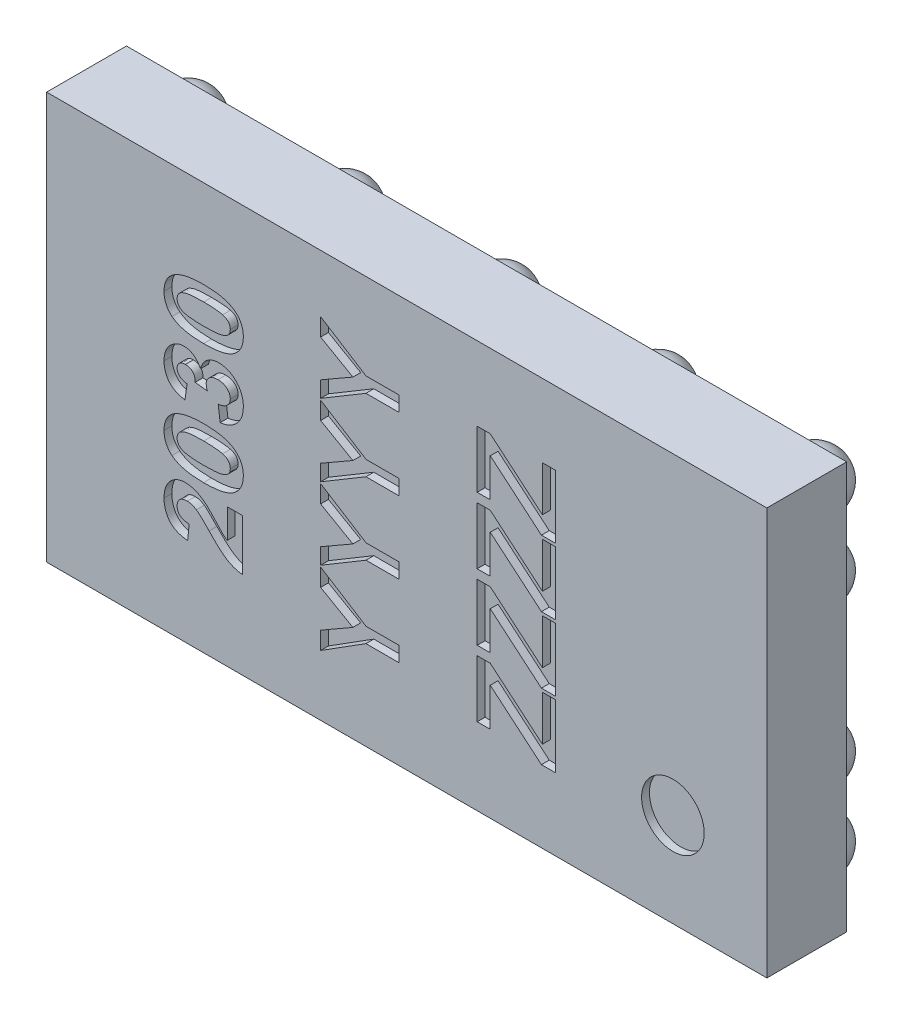
from build123d import *

# Parameters (mm, degrees)
SKETCH1_W              = 4.6
SKETCH1_H              = 2.6
BOSS_EXTRUDE1_DEPTH    = 0.51
SKETCH2_R              = 0.1845
BOSS_EXTRUDE2_DEPTH    = 0.28
FILLET1_R              = 0.1845
CUT_EXTRUDE1_START     = -0.05
CUT_EXTRUDE1_OUTLINE_R = 0.2
CUT_EXTRUDE1_DEPTH     = 0.05


# Read off the part's stored shape, not the designer's step: Cut-Extrude1
with BuildPart() as part:
    # Sketch1 → Boss-Extrude1 (new body)
    with BuildSketch(Plane.XY):
        Rectangle(SKETCH1_W, SKETCH1_H)
    extrude(amount=BOSS_EXTRUDE1_DEPTH)

    # Sketch2 → Boss-Extrude2 (add)
    with BuildSketch(Plane(origin=(0, 0, 0), x_dir=(-1, 0, 0), z_dir=(0, 0, -1))):
        with Locations((-2, -1)):
            Circle(SKETCH2_R)
        with Locations((-1, -1)):
            Circle(SKETCH2_R)
        with Locations((0, -1)):
            Circle(SKETCH2_R)
        with Locations((1, -1)):
            Circle(SKETCH2_R)
        with Locations((2, -1)):
            Circle(SKETCH2_R)
        with Locations((-1, -0.5)):
            Circle(SKETCH2_R)
        with Locations((0, -0.5)):
            Circle(SKETCH2_R)
        with Locations((1, -0.5)):
            Circle(SKETCH2_R)
        with Locations((2, -0.5)):
            Circle(SKETCH2_R)
        with Locations((-1, 0)):
            Circle(SKETCH2_R)
        Circle(SKETCH2_R)
        with Locations((1, 0)):
            Circle(SKETCH2_R)
        with Locations((2, 0)):
            Circle(SKETCH2_R)
        with Locations((-1, 0.5)):
            Circle(SKETCH2_R)
        with Locations((0, 0.5)):
            Circle(SKETCH2_R)
        with Locations((1, 0.5)):
            Circle(SKETCH2_R)
        with Locations((2, 0.5)):
            Circle(SKETCH2_R)
        with Locations((-1, 1)):
            Circle(SKETCH2_R)
        with Locations((0, 1)):
            Circle(SKETCH2_R)
        with Locations((1, 1)):
            Circle(SKETCH2_R)
        with Locations((2, 1)):
            Circle(SKETCH2_R)
        with Locations((-2, -0.5)):
            Circle(SKETCH2_R)
        with Locations((-2, 0.5)):
            Circle(SKETCH2_R)
        with Locations((-2, 1)):
            Circle(SKETCH2_R)
    extrude(amount=BOSS_EXTRUDE2_DEPTH)

    # Fillet1
    fillet1_edges = [part.edges().sort_by_distance(p)[0] for p in [
        (2.1845, -1, -0.28),
        (1.1845, -1, -0.28),
        (0.1845, -1, -0.28),
        (-0.8155, -1, -0.28),
        (-1.8155, -1, -0.28),
        (1.1845, -0.5, -0.28),
        (0.1845, -0.5, -0.28),
        (-0.8155, -0.5, -0.28),
        (-1.8155, -0.5, -0.28),
        (1.1845, 0, -0.28),
        (0.1845, 0, -0.28),
        (-0.8155, 0, -0.28),
        (-1.8155, 0, -0.28),
        (1.1845, 0.5, -0.28),
        (0.1845, 0.5, -0.28),
        (-0.8155, 0.5, -0.28),
        (-1.8155, 0.5, -0.28),
        (1.1845, 1, -0.28),
        (0.1845, 1, -0.28),
        (-0.8155, 1, -0.28),
        (-1.8155, 1, -0.28),
        (2.1845, -0.5, -0.28),
        (2.1845, 0.5, -0.28),
        (2.1845, 1, -0.28),
    ]]
    fillet(fillet1_edges, radius=FILLET1_R)

    # Cut-Extrude1 outline → Cut-Extrude1 (cut)
    # profile 1 of 13: a face of its own
    with BuildSketch(Plane.XY.offset(0.51).offset(CUT_EXTRUDE1_START)):
        with BuildLine():
            add(Edge.make_bspline(
                [(-1.05, -0.743589744), (-1.058217744, -0.742482862), (-1.074648626, -0.740269718), (-1.09864995, -0.733427391), (-1.122071373, -0.724295516), (-1.141129979, -0.714383677), (-1.156473322, -0.704527493), (-1.169039777, -0.695577899), (-1.18241686, -0.684948872), (-1.196612122, -0.672602297), (-1.211955669, -0.658970892), (-1.228087731, -0.643569954), (-1.245063337, -0.626550718), (-1.256583319, -0.614568932), (-1.262540064, -0.608373397)],
                knots=[0, 0, 0, 0, 0.096358043, 0.192662056, 0.289456702, 0.388481675, 0.441924118, 0.501524168, 0.567886246, 0.64060052, 0.72036895, 0.806635735, 0.900015327, 1, 1, 1, 1], degree=3))
            Line((-1.05, -0.743589744), (-1.05, -0.416666667))
            Line((-1.05, -0.416666667), (-1.146153846, -0.416666667))
            Line((-1.146153846, -0.416666667), (-1.146153846, -0.602463942))
            add(Edge.make_bspline(
                [(-1.288581731, -0.465144231), (-1.286666283, -0.466665027), (-1.282563838, -0.469922221), (-1.276273373, -0.475463564), (-1.269402201, -0.481885503), (-1.261821712, -0.489097332), (-1.25380035, -0.497337272), (-1.245002669, -0.506308849), (-1.235878699, -0.516406838), (-1.226200842, -0.526865909), (-1.216781517, -0.53737044), (-1.207835253, -0.547025625), (-1.199919714, -0.555795724), (-1.192597998, -0.563272389), (-1.186369587, -0.569895103), (-1.180915771, -0.575426024), (-1.176366663, -0.579966137), (-1.169263016, -0.586247984), (-1.15961129, -0.594125127), (-1.150487096, -0.599778873), (-1.146153846, -0.602463942)],
                knots=[0, 0, 0, 0, 0.036976407, 0.079194893, 0.12670469, 0.179189376, 0.23737566, 0.300567425, 0.369164049, 0.443125478, 0.516033644, 0.582490398, 0.642155791, 0.694640477, 0.740701329, 0.779612081, 0.812097798, 0.837838864, 0.922986647, 1, 1, 1, 1], degree=3))
            add(Edge.make_bspline(
                [(-1.413982372, -0.416666667), (-1.408532142, -0.416788997), (-1.397719723, -0.417031682), (-1.381735738, -0.419355211), (-1.366120341, -0.42290511), (-1.350835371, -0.428151582), (-1.335514175, -0.434801892), (-1.320122365, -0.443374301), (-1.304195751, -0.453327517), (-1.2938985, -0.461120492), (-1.288581731, -0.465144231)],
                knots=[0, 0, 0, 0, 0.119176244, 0.236427379, 0.352663848, 0.469086084, 0.589462908, 0.717601469, 0.854189467, 1, 1, 1, 1], degree=3))
            add(Edge.make_bspline(
                [(-1.55, -0.570112179), (-1.54988828, -0.564298573), (-1.549670692, -0.552975845), (-1.547873412, -0.53644684), (-1.544740654, -0.520918404), (-1.540587438, -0.506257634), (-1.535054809, -0.492604994), (-1.528332203, -0.479899705), (-1.520351034, -0.468191216), (-1.5112449, -0.457521844), (-1.501265107, -0.447899633), (-1.490523925, -0.439581629), (-1.479208884, -0.432517625), (-1.467372629, -0.426627087), (-1.454831605, -0.422247206), (-1.441751452, -0.419057484), (-1.428073256, -0.416942148), (-1.41873128, -0.416759509), (-1.413982372, -0.416666667)],
                knots=[0, 0, 0, 0, 0.075664954, 0.147366999, 0.216063694, 0.281670684, 0.345426338, 0.407446041, 0.468440098, 0.529485228, 0.589729945, 0.648582248, 0.705982067, 0.763124648, 0.820306879, 0.878491063, 0.938232054, 1, 1, 1, 1], degree=3))
            add(Edge.make_bspline(
                [(-1.399158654, -0.730769231), (-1.405650262, -0.729996182), (-1.418236452, -0.728497364), (-1.436314376, -0.724756795), (-1.452992751, -0.720020349), (-1.468237589, -0.714058663), (-1.482156323, -0.707130235), (-1.494524916, -0.698824664), (-1.505583529, -0.68958888), (-1.515124929, -0.679186899), (-1.523324518, -0.667887908), (-1.530479795, -0.655925723), (-1.536489303, -0.643271509), (-1.541410649, -0.629923241), (-1.54535378, -0.615936152), (-1.547958492, -0.601236302), (-1.549791361, -0.585916979), (-1.549929405, -0.575459847), (-1.55, -0.570112179)],
                knots=[0, 0, 0, 0, 0.079427738, 0.153997694, 0.22411895, 0.289905027, 0.352696857, 0.412684295, 0.470564976, 0.52742528, 0.583753121, 0.639984407, 0.696615464, 0.753751668, 0.812725863, 0.872976249, 0.93504139, 1, 1, 1, 1], degree=3))
            Line((-1.399158654, -0.730769231), (-1.38974359, -0.634615385))
            add(Edge.make_bspline(
                [(-1.466666667, -0.572115385), (-1.466468569, -0.576476078), (-1.466085886, -0.584899998), (-1.462758405, -0.596879131), (-1.456971977, -0.607313493), (-1.45049176, -0.614829623), (-1.444090116, -0.619886193), (-1.438447013, -0.623262474), (-1.432100941, -0.626259353), (-1.425074301, -0.628876623), (-1.417284016, -0.630951456), (-1.408782545, -0.632620136), (-1.39952619, -0.633965526), (-1.39308672, -0.6343933), (-1.38974359, -0.634615385)],
                knots=[0, 0, 0, 0, 0.116878943, 0.225784883, 0.330029364, 0.434784577, 0.489630396, 0.548321678, 0.610833711, 0.677730477, 0.749231697, 0.826888469, 0.910127039, 1, 1, 1, 1], degree=3))
            add(Edge.make_bspline(
                [(-1.401061699, -0.512820513), (-1.406051198, -0.512998854), (-1.415490943, -0.513336262), (-1.428829693, -0.516221714), (-1.440339546, -0.521234112), (-1.449963549, -0.528246543), (-1.457525423, -0.537031493), (-1.462947694, -0.547401538), (-1.466058518, -0.559319048), (-1.466457921, -0.567723085), (-1.466666667, -0.572115385)],
                knots=[0, 0, 0, 0, 0.149073932, 0.282036252, 0.405387865, 0.521790037, 0.635046385, 0.748908222, 0.86876897, 1, 1, 1, 1], degree=3))
            add(Edge.make_bspline(
                [(-1.343269231, -0.531850962), (-1.348078094, -0.528955986), (-1.357353835, -0.523371914), (-1.371940104, -0.517248516), (-1.386523361, -0.513573024), (-1.396267809, -0.513068647), (-1.401061699, -0.512820513)],
                knots=[0, 0, 0, 0, 0.27279555, 0.526191009, 0.766904419, 1, 1, 1, 1], degree=3))
            add(Edge.make_bspline(
                [(-1.262540064, -0.608373397), (-1.267312765, -0.603430772), (-1.276398583, -0.594021468), (-1.289395811, -0.580608806), (-1.301372524, -0.568881351), (-1.311860689, -0.558358641), (-1.321468323, -0.549671307), (-1.329734743, -0.542338052), (-1.336802341, -0.536454398), (-1.341282937, -0.533264899), (-1.343269231, -0.531850962)],
                knots=[0, 0, 0, 0, 0.185086692, 0.352350549, 0.503070353, 0.636624413, 0.752477777, 0.851888484, 0.93434063, 1, 1, 1, 1], degree=3))
        make_face()
    # profile 2 of 13: a face of its own
    with BuildSketch(Plane.XY.offset(0.51).offset(CUT_EXTRUDE1_START)):
        with BuildLine():
            add(Edge.make_bspline(
                [(-1.49921875, 0.459735577), (-1.503283605, 0.463212527), (-1.511307824, 0.470076194), (-1.521645512, 0.481943822), (-1.530490521, 0.49474904), (-1.53754679, 0.508672122), (-1.543274235, 0.523474208), (-1.547086469, 0.539376363), (-1.549573708, 0.556211398), (-1.549855876, 0.567799196), (-1.55, 0.573717949)],
                knots=[0, 0, 0, 0, 0.12395841, 0.244699883, 0.363941279, 0.484152368, 0.605999395, 0.731305741, 0.862757817, 1, 1, 1, 1], degree=3))
            add(Edge.make_bspline(
                [(-1.297596154, 0.41025641), (-1.303339464, 0.4102893), (-1.314595615, 0.410353759), (-1.331189046, 0.411024919), (-1.347164407, 0.411821187), (-1.362549659, 0.413308866), (-1.377321354, 0.414953763), (-1.391498968, 0.41702713), (-1.405009149, 0.41967745), (-1.417905817, 0.422563074), (-1.430234647, 0.425728407), (-1.441892583, 0.429490635), (-1.453055944, 0.433394575), (-1.463461949, 0.437984055), (-1.473329946, 0.442750687), (-1.482554868, 0.447979932), (-1.491218771, 0.453557764), (-1.496575226, 0.457694172), (-1.49921875, 0.459735577)],
                knots=[0, 0, 0, 0, 0.081529321, 0.15978699, 0.235742972, 0.308564204, 0.379173849, 0.446741566, 0.511904166, 0.574572995, 0.634354082, 0.692516127, 0.748439227, 0.802149263, 0.853871277, 0.903960434, 0.952602436, 1, 1, 1, 1], degree=3))
            add(Edge.make_bspline(
                [(-1.043589744, 0.573717949), (-1.043761952, 0.567731711), (-1.044099404, 0.556001368), (-1.046775737, 0.538875066), (-1.051060069, 0.522593797), (-1.057188033, 0.507225096), (-1.065098864, 0.492740516), (-1.074732167, 0.479173041), (-1.086228575, 0.466618386), (-1.096947197, 0.456808203), (-1.106626386, 0.449681031), (-1.114598537, 0.444526216), (-1.123248515, 0.439733456), (-1.132684046, 0.435474753), (-1.14266529, 0.431317763), (-1.153381532, 0.427649809), (-1.16475775, 0.42436189), (-1.176803511, 0.421313823), (-1.189589941, 0.418789858), (-1.203005431, 0.416443776), (-1.217112139, 0.41458136), (-1.231868764, 0.412954566), (-1.247338695, 0.411800492), (-1.263465043, 0.410865182), (-1.280299053, 0.410395794), (-1.291753254, 0.410303493), (-1.297596154, 0.41025641)],
                knots=[0, 0, 0, 0, 0.052414623, 0.102709169, 0.151443962, 0.199613898, 0.247250893, 0.295696137, 0.344975429, 0.396124037, 0.422679049, 0.450178653, 0.479237324, 0.509201646, 0.540809222, 0.573919385, 0.608346565, 0.644520595, 0.682718601, 0.722479931, 0.76379822, 0.80733297, 0.852506746, 0.899664657, 0.948817961, 1, 1, 1, 1], degree=3))
            add(Edge.make_bspline(
                [(-1.094370994, 0.687700321), (-1.09030653, 0.684223179), (-1.082283082, 0.677359134), (-1.071939744, 0.66549427), (-1.06313275, 0.652703194), (-1.055990997, 0.63882074), (-1.050341011, 0.623984643), (-1.046498111, 0.60806165), (-1.04401742, 0.591223933), (-1.043734336, 0.579636509), (-1.043589744, 0.573717949)],
                knots=[0, 0, 0, 0, 0.123953959, 0.244691097, 0.363928212, 0.483446761, 0.606013541, 0.731315388, 0.862762745, 1, 1, 1, 1], degree=3))
            add(Edge.make_bspline(
                [(-1.296594551, 0.737179487), (-1.290817877, 0.737146333), (-1.279495017, 0.737081347), (-1.26283449, 0.736415046), (-1.24679326, 0.735608114), (-1.231372858, 0.734136454), (-1.216537815, 0.732468157), (-1.202319941, 0.730432508), (-1.188798232, 0.727714613), (-1.17582295, 0.725022329), (-1.163503127, 0.721685416), (-1.151793402, 0.717957841), (-1.140611793, 0.714014488), (-1.130149985, 0.70947803), (-1.120261176, 0.704681952), (-1.111034525, 0.699456795), (-1.102371057, 0.693877934), (-1.097014546, 0.68974166), (-1.094370994, 0.687700321)],
                knots=[0, 0, 0, 0, 0.081774198, 0.160285604, 0.236029412, 0.309117924, 0.379530329, 0.447376833, 0.51235741, 0.574749217, 0.634941361, 0.692940937, 0.748707822, 0.802701936, 0.854279471, 0.90422871, 0.952734836, 1, 1, 1, 1], degree=3))
            add(Edge.make_bspline(
                [(-1.498617788, 0.688100962), (-1.496006883, 0.690108308), (-1.490678482, 0.69420495), (-1.482068374, 0.699722206), (-1.472934949, 0.705026297), (-1.463058362, 0.709656251), (-1.452610005, 0.714089632), (-1.441566069, 0.718198116), (-1.429835307, 0.721765385), (-1.417567716, 0.725121976), (-1.404571707, 0.72785729), (-1.390987578, 0.730384973), (-1.376753748, 0.732480536), (-1.361915756, 0.734133011), (-1.346496178, 0.735608835), (-1.330421432, 0.736417515), (-1.313727414, 0.737079652), (-1.302371213, 0.737145826), (-1.296594551, 0.737179487)],
                knots=[0, 0, 0, 0, 0.046672607, 0.095250611, 0.144862331, 0.19630984, 0.249763002, 0.30577477, 0.363267072, 0.423548412, 0.486032674, 0.55148718, 0.619434222, 0.689950967, 0.763147784, 0.839003833, 0.918104626, 1, 1, 1, 1], degree=3))
            add(Edge.make_bspline(
                [(-1.55, 0.573717949), (-1.54985645, 0.579669615), (-1.549576974, 0.591256826), (-1.547101322, 0.608140668), (-1.543131753, 0.624037647), (-1.537520485, 0.638946594), (-1.53023393, 0.652853542), (-1.521240949, 0.665665858), (-1.510811115, 0.677663508), (-1.502717392, 0.684591713), (-1.498617788, 0.688100962)],
                knots=[0, 0, 0, 0, 0.137323095, 0.267352326, 0.392964616, 0.514920445, 0.63419982, 0.754352431, 0.875575492, 1, 1, 1, 1], degree=3))
        make_face()
        with BuildLine():
            add(Edge.make_bspline(
                [(-1.296594551, 0.641025641), (-1.303406081, 0.641030325), (-1.316463671, 0.641039303), (-1.335225611, 0.640448829), (-1.352333051, 0.639871498), (-1.367784785, 0.638682896), (-1.38160238, 0.637514078), (-1.393713066, 0.635745275), (-1.404218097, 0.63396882), (-1.415532956, 0.630952474), (-1.427416562, 0.626792335), (-1.439518283, 0.621185769), (-1.44906381, 0.614817468), (-1.456081067, 0.607584963), (-1.460811335, 0.599738239), (-1.464222522, 0.591539443), (-1.466247209, 0.582796397), (-1.466525819, 0.57676636), (-1.466666667, 0.573717949)],
                knots=[0, 0, 0, 0, 0.100694087, 0.193028879, 0.277503892, 0.353710807, 0.422128145, 0.482439417, 0.534622677, 0.579517896, 0.655386777, 0.720514811, 0.776238326, 0.824065889, 0.868172739, 0.910887747, 0.954950385, 1, 1, 1, 1], degree=3))
            add(Edge.make_bspline(
                [(-1.176001603, 0.630308494), (-1.179230979, 0.631181324), (-1.186140123, 0.633048715), (-1.197385145, 0.63519611), (-1.210160454, 0.636959253), (-1.224460366, 0.638429912), (-1.240322295, 0.639650092), (-1.257726796, 0.640387885), (-1.276659601, 0.640902684), (-1.289783259, 0.64098363), (-1.296594551, 0.641025641)],
                knots=[0, 0, 0, 0, 0.082643029, 0.176812049, 0.282637889, 0.401264311, 0.531994304, 0.675700987, 0.83168601, 1, 1, 1, 1], degree=3))
            add(Edge.make_bspline(
                [(-1.126923077, 0.573717949), (-1.127055704, 0.576801932), (-1.127315251, 0.582837169), (-1.12943168, 0.591614637), (-1.132709927, 0.599905172), (-1.137524391, 0.607684192), (-1.144043202, 0.61488848), (-1.152851696, 0.620992419), (-1.163648974, 0.626269171), (-1.171721744, 0.628908975), (-1.176001603, 0.630308494)],
                knots=[0, 0, 0, 0, 0.113638489, 0.222386181, 0.331252377, 0.441310371, 0.558128127, 0.686986266, 0.834052658, 1, 1, 1, 1], degree=3))
            add(Edge.make_bspline(
                [(-1.296594551, 0.506410256), (-1.289783735, 0.506467301), (-1.276728544, 0.506576646), (-1.257990374, 0.506887487), (-1.240933223, 0.507768356), (-1.225489706, 0.50865333), (-1.211739516, 0.510111586), (-1.19961828, 0.511609744), (-1.189199981, 0.513634786), (-1.177805573, 0.516430922), (-1.165868702, 0.520606109), (-1.153846129, 0.526357839), (-1.144292262, 0.532609998), (-1.137388746, 0.539855208), (-1.13279766, 0.547772451), (-1.129242571, 0.555900711), (-1.127370164, 0.564687471), (-1.127073865, 0.57067225), (-1.126923077, 0.573717949)],
                knots=[0, 0, 0, 0, 0.10085914, 0.193330056, 0.277468309, 0.353763757, 0.422338906, 0.48218998, 0.534548001, 0.579392725, 0.655849782, 0.721297308, 0.776422763, 0.823986491, 0.867906029, 0.911335893, 0.954878168, 1, 1, 1, 1], degree=3))
            add(Edge.make_bspline(
                [(-1.417588141, 0.517127404), (-1.414359026, 0.516253259), (-1.407418804, 0.51437449), (-1.396103245, 0.512243237), (-1.383228916, 0.510476035), (-1.368861646, 0.509011982), (-1.35296708, 0.50778474), (-1.335562433, 0.507048348), (-1.316596297, 0.506532153), (-1.303439237, 0.50645197), (-1.296594551, 0.506410256)],
                knots=[0, 0, 0, 0, 0.082373489, 0.177042428, 0.283337382, 0.402394786, 0.532698404, 0.675936388, 0.831412667, 1, 1, 1, 1], degree=3))
            add(Edge.make_bspline(
                [(-1.466666667, 0.573717949), (-1.466526953, 0.57066903), (-1.466250587, 0.564637989), (-1.464202448, 0.555872006), (-1.460822571, 0.547593258), (-1.456104307, 0.539761836), (-1.449540552, 0.532550795), (-1.440739966, 0.526442397), (-1.429940188, 0.521167055), (-1.421867798, 0.518527036), (-1.417588141, 0.517127404)],
                knots=[0, 0, 0, 0, 0.112423958, 0.222384858, 0.330122406, 0.441243168, 0.558074976, 0.686948615, 0.834032697, 1, 1, 1, 1], degree=3))
        make_face(mode=Mode.SUBTRACT)
    # profile 3 of 13: a face of its own
    with BuildSketch(Plane.XY.offset(0.51).offset(CUT_EXTRUDE1_START)):
        with BuildLine():
            add(Edge.make_bspline(
                [(-1.043589744, 0.18739984), (-1.043682161, 0.181950791), (-1.04386369, 0.171247577), (-1.045974594, 0.155572896), (-1.049154412, 0.140592975), (-1.05353249, 0.126264727), (-1.059357637, 0.112703703), (-1.06657798, 0.099920575), (-1.074848238, 0.087728742), (-1.084516496, 0.076482545), (-1.095058941, 0.066027799), (-1.106651327, 0.056844098), (-1.118925252, 0.04866032), (-1.131989107, 0.041621455), (-1.145876953, 0.035786536), (-1.160552912, 0.031243242), (-1.175972052, 0.027619878), (-1.186601765, 0.026309733), (-1.192027244, 0.025641026)],
                knots=[0, 0, 0, 0, 0.067342932, 0.132277377, 0.19519731, 0.256574433, 0.31723782, 0.377309645, 0.437890082, 0.499107306, 0.560417739, 0.62122146, 0.681682194, 0.742641307, 0.804444646, 0.867644354, 0.93244478, 1, 1, 1, 1], degree=3))
            add(Edge.make_bspline(
                [(-1.199839744, 0.352564103), (-1.194521972, 0.352451898), (-1.184034611, 0.352230616), (-1.168642921, 0.349800106), (-1.153850514, 0.346107404), (-1.139597544, 0.341018582), (-1.126058713, 0.334212779), (-1.113042882, 0.326075168), (-1.100684302, 0.316380931), (-1.089058809, 0.305336385), (-1.078457848, 0.293216181), (-1.068967205, 0.2803412), (-1.061226769, 0.266558133), (-1.054715078, 0.252132172), (-1.049750906, 0.236977577), (-1.046083014, 0.221099789), (-1.043990559, 0.204483546), (-1.043724607, 0.193148051), (-1.043589744, 0.18739984)],
                knots=[0, 0, 0, 0, 0.06290302, 0.124053213, 0.183964688, 0.243226016, 0.302792328, 0.362995117, 0.424662965, 0.488404729, 0.552541054, 0.61507421, 0.677382139, 0.739302776, 0.802169777, 0.865831845, 0.931963539, 1, 1, 1, 1], degree=3))
            add(Edge.make_bspline(
                [(-1.316726763, 0.261418269), (-1.315923867, 0.264809115), (-1.314336934, 0.271511155), (-1.310863275, 0.281090007), (-1.306839702, 0.290208112), (-1.302161146, 0.298815533), (-1.296708148, 0.306908789), (-1.290499957, 0.314389895), (-1.283595029, 0.32135062), (-1.276159083, 0.327869155), (-1.268023597, 0.333616117), (-1.259546235, 0.3387991), (-1.250534349, 0.342964556), (-1.241215899, 0.346526611), (-1.231441281, 0.349180941), (-1.221283348, 0.351259417), (-1.210678952, 0.352301227), (-1.203480676, 0.352475802), (-1.199839744, 0.352564103)],
                knots=[0, 0, 0, 0, 0.064842474, 0.128161798, 0.189395552, 0.250328711, 0.310338176, 0.370838413, 0.431069701, 0.492775095, 0.554714963, 0.616345137, 0.677531527, 0.739312049, 0.801913033, 0.865927544, 0.932185316, 1, 1, 1, 1], degree=3))
            add(Edge.make_bspline(
                [(-1.421794872, 0.333333333), (-1.416434025, 0.333137493), (-1.405866811, 0.332751457), (-1.390494652, 0.329209099), (-1.375963132, 0.323515568), (-1.362216742, 0.315643045), (-1.349383042, 0.305379104), (-1.337577509, 0.292743816), (-1.326349637, 0.27810846), (-1.320007479, 0.267108437), (-1.316726763, 0.261418269)],
                knots=[0, 0, 0, 0, 0.119696472, 0.235943758, 0.350562429, 0.467573879, 0.588679097, 0.716432135, 0.853314044, 1, 1, 1, 1], degree=3))
            add(Edge.make_bspline(
                [(-1.505028045, 0.299078526), (-1.501968529, 0.301804153), (-1.495925668, 0.307187551), (-1.486237376, 0.314177168), (-1.476170367, 0.320027101), (-1.465934692, 0.324989357), (-1.455292997, 0.328679597), (-1.444412331, 0.331430701), (-1.433196282, 0.33306476), (-1.425606169, 0.333243554), (-1.421794872, 0.333333333)],
                knots=[0, 0, 0, 0, 0.133197834, 0.26307954, 0.387661103, 0.511507105, 0.632385612, 0.753259243, 0.876101653, 1, 1, 1, 1], degree=3))
            add(Edge.make_bspline(
                [(-1.55, 0.188701923), (-1.54987221, 0.194317819), (-1.549622531, 0.205290269), (-1.547474094, 0.221290702), (-1.543983935, 0.236429835), (-1.539046862, 0.250728772), (-1.532760827, 0.264253799), (-1.524851944, 0.276779127), (-1.515722972, 0.288567517), (-1.508618397, 0.295549916), (-1.505028045, 0.299078526)],
                knots=[0, 0, 0, 0, 0.137122337, 0.267912364, 0.393522698, 0.516023782, 0.636775151, 0.75693024, 0.877162791, 1, 1, 1, 1], degree=3))
            add(Edge.make_bspline(
                [(-1.416987179, 0.038461538), (-1.424327874, 0.040047739), (-1.438379606, 0.043084083), (-1.458074078, 0.049275458), (-1.475462519, 0.056593925), (-1.49079326, 0.064995632), (-1.504144345, 0.07516794), (-1.515794364, 0.087078388), (-1.526009884, 0.100747078), (-1.53455863, 0.116092083), (-1.541470142, 0.132753371), (-1.546343805, 0.150556181), (-1.54946389, 0.169294766), (-1.549818881, 0.182145441), (-1.55, 0.188701923)],
                knots=[0, 0, 0, 0, 0.101735823, 0.194745156, 0.279283817, 0.357066803, 0.430997627, 0.505862571, 0.582144147, 0.661553634, 0.743306573, 0.825964676, 0.911206255, 1, 1, 1, 1], degree=3))
            Line((-1.416987179, 0.038461538), (-1.402564103, 0.134615385))
            add(Edge.make_bspline(
                [(-1.466666667, 0.189503205), (-1.466494946, 0.186037647), (-1.466157403, 0.179225559), (-1.462831793, 0.169471961), (-1.457666813, 0.160517477), (-1.450395175, 0.152514866), (-1.441185989, 0.145644054), (-1.42993752, 0.14036149), (-1.416880046, 0.136578892), (-1.407495739, 0.135291785), (-1.402564103, 0.134615385)],
                knots=[0, 0, 0, 0, 0.111217139, 0.21861436, 0.327925018, 0.442078801, 0.564167725, 0.695394216, 0.839923722, 1, 1, 1, 1], degree=3))
            add(Edge.make_bspline(
                [(-1.41338141, 0.237179487), (-1.417233755, 0.237038442), (-1.424620346, 0.236767998), (-1.435136357, 0.234357391), (-1.444426537, 0.230196948), (-1.452386621, 0.224486184), (-1.458822489, 0.217400446), (-1.463418391, 0.20907102), (-1.46620789, 0.199627579), (-1.466509945, 0.192961761), (-1.466666667, 0.189503205)],
                knots=[0, 0, 0, 0, 0.143314165, 0.274794548, 0.398878677, 0.51998758, 0.637066928, 0.752263196, 0.871461917, 1, 1, 1, 1], degree=3))
            add(Edge.make_bspline(
                [(-1.351282051, 0.169270833), (-1.351236148, 0.171942919), (-1.351147074, 0.177128089), (-1.351775754, 0.184699422), (-1.35291873, 0.191788532), (-1.354789381, 0.198369343), (-1.357012302, 0.204495651), (-1.359992587, 0.210087636), (-1.363490726, 0.215191845), (-1.368818004, 0.221330377), (-1.376708299, 0.227709925), (-1.387649424, 0.23338079), (-1.400118087, 0.236570144), (-1.408856512, 0.236971604), (-1.41338141, 0.237179487)],
                knots=[0, 0, 0, 0, 0.076418853, 0.148290419, 0.21707402, 0.281501108, 0.343774854, 0.403168701, 0.462254486, 0.5204847, 0.63521244, 0.750134874, 0.870615806, 1, 1, 1, 1], degree=3))
            Line((-1.351282051, 0.169270833), (-1.273657853, 0.16025641))
            add(Edge.make_bspline(
                [(-1.280769231, 0.198417468), (-1.28069818, 0.195640752), (-1.280547559, 0.189754406), (-1.27898259, 0.180598515), (-1.276822863, 0.170613975), (-1.274745348, 0.163815263), (-1.273657853, 0.16025641)],
                knots=[0, 0, 0, 0, 0.213631379, 0.452875981, 0.713602586, 1, 1, 1, 1], degree=3))
            add(Edge.make_bspline(
                [(-1.20614984, 0.256410256), (-1.2116083, 0.2562067), (-1.221988241, 0.255819612), (-1.236739401, 0.252692101), (-1.249747726, 0.24743251), (-1.260731084, 0.239935098), (-1.269551615, 0.231067837), (-1.27618046, 0.221129749), (-1.279988959, 0.210032509), (-1.280507222, 0.202317706), (-1.280769231, 0.198417468)],
                knots=[0, 0, 0, 0, 0.155197121, 0.2951266, 0.426734151, 0.551888719, 0.670786725, 0.780663264, 0.889113767, 1, 1, 1, 1], degree=3))
            add(Edge.make_bspline(
                [(-1.126923077, 0.189403045), (-1.126973567, 0.191710007), (-1.12707358, 0.196279739), (-1.128089685, 0.203004138), (-1.129829706, 0.209427383), (-1.132079556, 0.215636641), (-1.135284795, 0.221383744), (-1.138848743, 0.227031421), (-1.143363521, 0.232178943), (-1.148284529, 0.237213002), (-1.153891681, 0.241678092), (-1.159973782, 0.2456119), (-1.166472199, 0.249064842), (-1.173554024, 0.251741266), (-1.18106598, 0.253836295), (-1.189040642, 0.255334042), (-1.197447957, 0.25624557), (-1.203209469, 0.256354609), (-1.20614984, 0.256410256)],
                knots=[0, 0, 0, 0, 0.059479625, 0.117819845, 0.174848593, 0.230992612, 0.287629853, 0.344240898, 0.402904405, 0.463801144, 0.525670553, 0.587299737, 0.650474051, 0.715087758, 0.782162689, 0.851413822, 0.924169499, 1, 1, 1, 1], degree=3))
            add(Edge.make_bspline(
                [(-1.203846154, 0.121794872), (-1.197933179, 0.122624452), (-1.18670952, 0.124199112), (-1.171185009, 0.129124074), (-1.157662836, 0.135493929), (-1.146684777, 0.144095314), (-1.137767246, 0.153807256), (-1.131497483, 0.164804388), (-1.127527152, 0.176782878), (-1.127127538, 0.185131499), (-1.126923077, 0.189403045)],
                knots=[0, 0, 0, 0, 0.158307815, 0.300490536, 0.430954139, 0.552972738, 0.668507776, 0.778927929, 0.886889152, 1, 1, 1, 1], degree=3))
            Line((-1.203846154, 0.121794872), (-1.192027244, 0.025641026))
        make_face()
    # profile 4 of 13: a face of its own
    with BuildSketch(Plane.XY.offset(0.51).offset(CUT_EXTRUDE1_START)):
        with BuildLine():
            add(Edge.make_bspline(
                [(-1.49921875, -0.309495192), (-1.503283605, -0.306018242), (-1.511307824, -0.299154575), (-1.521645512, -0.287286947), (-1.530490521, -0.274481729), (-1.53754679, -0.260558648), (-1.543274235, -0.245756561), (-1.547086469, -0.229854407), (-1.549573708, -0.213019372), (-1.549855876, -0.201431573), (-1.55, -0.195512821)],
                knots=[0, 0, 0, 0, 0.12395841, 0.244699883, 0.363941279, 0.484152368, 0.605999395, 0.731305741, 0.862757817, 1, 1, 1, 1], degree=3))
            add(Edge.make_bspline(
                [(-1.297596154, -0.358974359), (-1.303339464, -0.358941469), (-1.314595615, -0.35887701), (-1.331189046, -0.35820585), (-1.347164407, -0.357409582), (-1.362549659, -0.355921904), (-1.377321354, -0.354277006), (-1.391498968, -0.352203639), (-1.405009149, -0.349553319), (-1.417905817, -0.346667695), (-1.430234647, -0.343502362), (-1.441892583, -0.339740135), (-1.453055944, -0.335836194), (-1.463461949, -0.331246715), (-1.473329946, -0.326480082), (-1.482554868, -0.321250837), (-1.491218771, -0.315673005), (-1.496575226, -0.311536597), (-1.49921875, -0.309495192)],
                knots=[0, 0, 0, 0, 0.081529321, 0.15978699, 0.235742972, 0.308564204, 0.379173849, 0.446741566, 0.511904166, 0.574572995, 0.634354082, 0.692516127, 0.748439227, 0.802149263, 0.853871277, 0.903960434, 0.952602436, 1, 1, 1, 1], degree=3))
            add(Edge.make_bspline(
                [(-1.043589744, -0.195512821), (-1.043761952, -0.201499058), (-1.044099404, -0.213229401), (-1.046775737, -0.230355703), (-1.051060069, -0.246636972), (-1.057188033, -0.262005673), (-1.065098864, -0.276490254), (-1.074732167, -0.290057728), (-1.086228575, -0.302612384), (-1.096947197, -0.312422566), (-1.106626386, -0.319549738), (-1.114598537, -0.324704553), (-1.123248515, -0.329497313), (-1.132684046, -0.333756016), (-1.14266529, -0.337913006), (-1.153381532, -0.341580961), (-1.16475775, -0.34486888), (-1.176803511, -0.347916946), (-1.189589941, -0.350440911), (-1.203005431, -0.352786993), (-1.217112139, -0.354649409), (-1.231868764, -0.356276203), (-1.247338695, -0.357430277), (-1.263465043, -0.358365587), (-1.280299053, -0.358834976), (-1.291753254, -0.358927276), (-1.297596154, -0.358974359)],
                knots=[0, 0, 0, 0, 0.052414623, 0.102709169, 0.151443962, 0.199613898, 0.247250893, 0.295696137, 0.344975429, 0.396124037, 0.422679049, 0.450178653, 0.479237324, 0.509201646, 0.540809222, 0.573919385, 0.608346565, 0.644520595, 0.682718601, 0.722479931, 0.76379822, 0.80733297, 0.852506746, 0.899664657, 0.948817961, 1, 1, 1, 1], degree=3))
            add(Edge.make_bspline(
                [(-1.094370994, -0.081530449), (-1.09030653, -0.08500759), (-1.082283082, -0.091871635), (-1.071939744, -0.103736499), (-1.06313275, -0.116527575), (-1.055990997, -0.130410029), (-1.050341011, -0.145246126), (-1.046498111, -0.161169119), (-1.04401742, -0.178006837), (-1.043734336, -0.18959426), (-1.043589744, -0.195512821)],
                knots=[0, 0, 0, 0, 0.123953959, 0.244691097, 0.363928212, 0.483446761, 0.606013541, 0.731315388, 0.862762745, 1, 1, 1, 1], degree=3))
            add(Edge.make_bspline(
                [(-1.296594551, -0.032051282), (-1.290817877, -0.032084436), (-1.279495017, -0.032149422), (-1.26283449, -0.032815723), (-1.24679326, -0.033622655), (-1.231372858, -0.035094315), (-1.216537815, -0.036762612), (-1.202319941, -0.038798262), (-1.188798232, -0.041516157), (-1.17582295, -0.044208441), (-1.163503127, -0.047545353), (-1.151793402, -0.051272928), (-1.140611793, -0.055216282), (-1.130149985, -0.05975274), (-1.120261176, -0.064548818), (-1.111034525, -0.069773974), (-1.102371057, -0.075352835), (-1.097014546, -0.079489109), (-1.094370994, -0.081530449)],
                knots=[0, 0, 0, 0, 0.081774198, 0.160285604, 0.236029412, 0.309117924, 0.379530329, 0.447376833, 0.51235741, 0.574749217, 0.634941361, 0.692940937, 0.748707822, 0.802701936, 0.854279471, 0.90422871, 0.952734836, 1, 1, 1, 1], degree=3))
            add(Edge.make_bspline(
                [(-1.498617788, -0.081129808), (-1.496006883, -0.079122461), (-1.490678482, -0.075025819), (-1.482068374, -0.069508563), (-1.472934949, -0.064204472), (-1.463058362, -0.059574518), (-1.452610005, -0.055141137), (-1.441566069, -0.051032653), (-1.429835307, -0.047465384), (-1.417567716, -0.044108793), (-1.404571707, -0.041373479), (-1.390987578, -0.038845796), (-1.376753748, -0.036750233), (-1.361915756, -0.035097758), (-1.346496178, -0.033621934), (-1.330421432, -0.032813254), (-1.313727414, -0.032151118), (-1.302371213, -0.032084943), (-1.296594551, -0.032051282)],
                knots=[0, 0, 0, 0, 0.046672607, 0.095250611, 0.144862331, 0.19630984, 0.249763002, 0.30577477, 0.363267072, 0.423548412, 0.486032674, 0.55148718, 0.619434222, 0.689950967, 0.763147784, 0.839003833, 0.918104626, 1, 1, 1, 1], degree=3))
            add(Edge.make_bspline(
                [(-1.55, -0.195512821), (-1.54985645, -0.189561155), (-1.549576974, -0.177973943), (-1.547101322, -0.161090101), (-1.543131753, -0.145193123), (-1.537520485, -0.130284176), (-1.53023393, -0.116377227), (-1.521240949, -0.103564911), (-1.510811115, -0.091567261), (-1.502717392, -0.084639056), (-1.498617788, -0.081129808)],
                knots=[0, 0, 0, 0, 0.137323095, 0.267352326, 0.392964616, 0.514920445, 0.63419982, 0.754352431, 0.875575492, 1, 1, 1, 1], degree=3))
        make_face()
        with BuildLine():
            add(Edge.make_bspline(
                [(-1.296594551, -0.128205128), (-1.303406081, -0.128200444), (-1.316463671, -0.128191466), (-1.335225611, -0.128781941), (-1.352333051, -0.129359271), (-1.367784785, -0.130547873), (-1.38160238, -0.131716691), (-1.393713066, -0.133485494), (-1.404218097, -0.135261949), (-1.415532956, -0.138278295), (-1.427416562, -0.142438434), (-1.439518283, -0.148045), (-1.44906381, -0.154413302), (-1.456081067, -0.161645806), (-1.460811335, -0.16949253), (-1.464222522, -0.177691326), (-1.466247209, -0.186434372), (-1.466525819, -0.192464409), (-1.466666667, -0.195512821)],
                knots=[0, 0, 0, 0, 0.100694087, 0.193028879, 0.277503892, 0.353710807, 0.422128145, 0.482439417, 0.534622677, 0.579517896, 0.655386777, 0.720514811, 0.776238326, 0.824065889, 0.868172739, 0.910887747, 0.954950385, 1, 1, 1, 1], degree=3))
            add(Edge.make_bspline(
                [(-1.176001603, -0.138922276), (-1.179230979, -0.138049446), (-1.186140123, -0.136182054), (-1.197385145, -0.134034659), (-1.210160454, -0.132271516), (-1.224460366, -0.130800857), (-1.240322295, -0.129580677), (-1.257726796, -0.128842884), (-1.276659601, -0.128328085), (-1.289783259, -0.12824714), (-1.296594551, -0.128205128)],
                knots=[0, 0, 0, 0, 0.082643029, 0.176812049, 0.282637889, 0.401264311, 0.531994304, 0.675700987, 0.83168601, 1, 1, 1, 1], degree=3))
            add(Edge.make_bspline(
                [(-1.126923077, -0.195512821), (-1.127055704, -0.192428837), (-1.127315251, -0.1863936), (-1.12943168, -0.177616132), (-1.132709927, -0.169325597), (-1.137524391, -0.161546577), (-1.144043202, -0.154342289), (-1.152851696, -0.148238351), (-1.163648974, -0.142961599), (-1.171721744, -0.140321794), (-1.176001603, -0.138922276)],
                knots=[0, 0, 0, 0, 0.113638489, 0.222386181, 0.331252377, 0.441310371, 0.558128127, 0.686986266, 0.834052658, 1, 1, 1, 1], degree=3))
            add(Edge.make_bspline(
                [(-1.296594551, -0.262820513), (-1.289783735, -0.262763468), (-1.276728544, -0.262654123), (-1.257990374, -0.262343283), (-1.240933223, -0.261462413), (-1.225489706, -0.26057744), (-1.211739516, -0.259119183), (-1.19961828, -0.257621025), (-1.189199981, -0.255595983), (-1.177805573, -0.252799848), (-1.165868702, -0.24862466), (-1.153846129, -0.242872931), (-1.144292262, -0.236620771), (-1.137388746, -0.229375561), (-1.13279766, -0.221458319), (-1.129242571, -0.213330058), (-1.127370164, -0.204543298), (-1.127073865, -0.19855852), (-1.126923077, -0.195512821)],
                knots=[0, 0, 0, 0, 0.10085914, 0.193330056, 0.277468309, 0.353763757, 0.422338906, 0.48218998, 0.534548001, 0.579392725, 0.655849782, 0.721297308, 0.776422763, 0.823986491, 0.867906029, 0.911335893, 0.954878168, 1, 1, 1, 1], degree=3))
            add(Edge.make_bspline(
                [(-1.417588141, -0.252103365), (-1.414359026, -0.25297751), (-1.407418804, -0.25485628), (-1.396103245, -0.256987532), (-1.383228916, -0.258754734), (-1.368861646, -0.260218787), (-1.35296708, -0.261446029), (-1.335562433, -0.262182421), (-1.316596297, -0.262698616), (-1.303439237, -0.262778799), (-1.296594551, -0.262820513)],
                knots=[0, 0, 0, 0, 0.082373489, 0.177042428, 0.283337382, 0.402394786, 0.532698404, 0.675936388, 0.831412667, 1, 1, 1, 1], degree=3))
            add(Edge.make_bspline(
                [(-1.466666667, -0.195512821), (-1.466526953, -0.19856174), (-1.466250587, -0.20459278), (-1.464202448, -0.213358763), (-1.460822571, -0.221637511), (-1.456104307, -0.229468933), (-1.449540552, -0.236679974), (-1.440739966, -0.242788372), (-1.429940188, -0.248063714), (-1.421867798, -0.250703733), (-1.417588141, -0.252103365)],
                knots=[0, 0, 0, 0, 0.112423958, 0.222384858, 0.330122406, 0.441243168, 0.558074976, 0.686948615, 0.834032697, 1, 1, 1, 1], degree=3))
        make_face(mode=Mode.SUBTRACT)
    # profile 5 of 13: a face of its own
    with BuildSketch(Plane.XY.offset(0.51).offset(CUT_EXTRUDE1_START)):
        Polygon((0.95, -0.416666667), (0.95, -0.012820513), (0.866666667, -0.012820513), (0.866666667, -0.300580929), (0.533333333, -0.019230769), (0.45, -0.019230769), (0.45, -0.384615385), (0.533333333, -0.384615385), (0.533333333, -0.140825321), (0.86025641, -0.416666667), align=None)
    # profile 6 of 13: a face of its own
    with BuildSketch(Plane.XY.offset(0.51).offset(CUT_EXTRUDE1_START)):
        Polygon((0.95, 0.006410256), (0.95, 0.41025641), (0.866666667, 0.41025641), (0.866666667, 0.122495994), (0.533333333, 0.403846154), (0.45, 0.403846154), (0.45, 0.038461538), (0.533333333, 0.038461538), (0.533333333, 0.282251603), (0.86025641, 0.006410256), align=None)
    # profile 7 of 13: a face of its own
    with BuildSketch(Plane.XY.offset(0.51).offset(CUT_EXTRUDE1_START)):
        Polygon((0.95, 0.429487179), (0.95, 0.833333333), (0.866666667, 0.833333333), (0.866666667, 0.545572917), (0.533333333, 0.826923077), (0.45, 0.826923077), (0.45, 0.461538462), (0.533333333, 0.461538462), (0.533333333, 0.705328526), (0.86025641, 0.429487179), align=None)
    # profile 8 of 13: a face of its own
    with BuildSketch(Plane.XY.offset(0.51).offset(CUT_EXTRUDE1_START)):
        Polygon((0.95, -0.83974359), (0.95, -0.435897436), (0.866666667, -0.435897436), (0.866666667, -0.723657853), (0.533333333, -0.442307692), (0.45, -0.442307692), (0.45, -0.807692308), (0.533333333, -0.807692308), (0.533333333, -0.563902244), (0.86025641, -0.83974359), align=None)
    # profile 9 of 13: a face of its own
    with BuildSketch(Plane.XY.offset(0.51).offset(CUT_EXTRUDE1_START)):
        with Locations((1.7, -0.7)):
            Circle(CUT_EXTRUDE1_OUTLINE_R)
    # profile 10 of 13: a face of its own
    with BuildSketch(Plane.XY.offset(0.51).offset(CUT_EXTRUDE1_START)):
        Polygon((-0.05, -0.730769231), (-0.05, -0.634615385), (-0.259735577, -0.634615385), (-0.55, -0.451923077), (-0.55, -0.564403045), (-0.343970353, -0.682792468), (-0.55, -0.800981571), (-0.55, -0.913461538), (-0.260436699, -0.730769231), align=None)
    # profile 11 of 13: a face of its own
    with BuildSketch(Plane.XY.offset(0.51).offset(CUT_EXTRUDE1_START)):
        Polygon((-0.05, 0.653846154), (-0.05, 0.75), (-0.259735577, 0.75), (-0.55, 0.932692308), (-0.55, 0.82021234), (-0.343970353, 0.701822917), (-0.55, 0.583633814), (-0.55, 0.481153846), (-0.260436699, 0.653846154), align=None)
    # profile 12 of 13: a face of its own
    with BuildSketch(Plane.XY.offset(0.51).offset(CUT_EXTRUDE1_START)):
        Polygon((-0.05, 0.192307692), (-0.05, 0.288461538), (-0.259735577, 0.288461538), (-0.55, 0.471153846), (-0.55, 0.358673878), (-0.343970353, 0.240284455), (-0.55, 0.122095353), (-0.55, 0.019615385), (-0.260436699, 0.192307692), align=None)
    # profile 13 of 13: a face of its own
    with BuildSketch(Plane.XY.offset(0.51).offset(CUT_EXTRUDE1_START)):
        Polygon((-0.05, -0.269230769), (-0.05, -0.173076923), (-0.259735577, -0.173076923), (-0.55, 0.009615385), (-0.55, -0.102864583), (-0.343970353, -0.221254006), (-0.55, -0.339443109), (-0.55, -0.441923077), (-0.260436699, -0.269230769), align=None)
    extrude(amount=CUT_EXTRUDE1_DEPTH, mode=Mode.SUBTRACT)


solid = part.part
